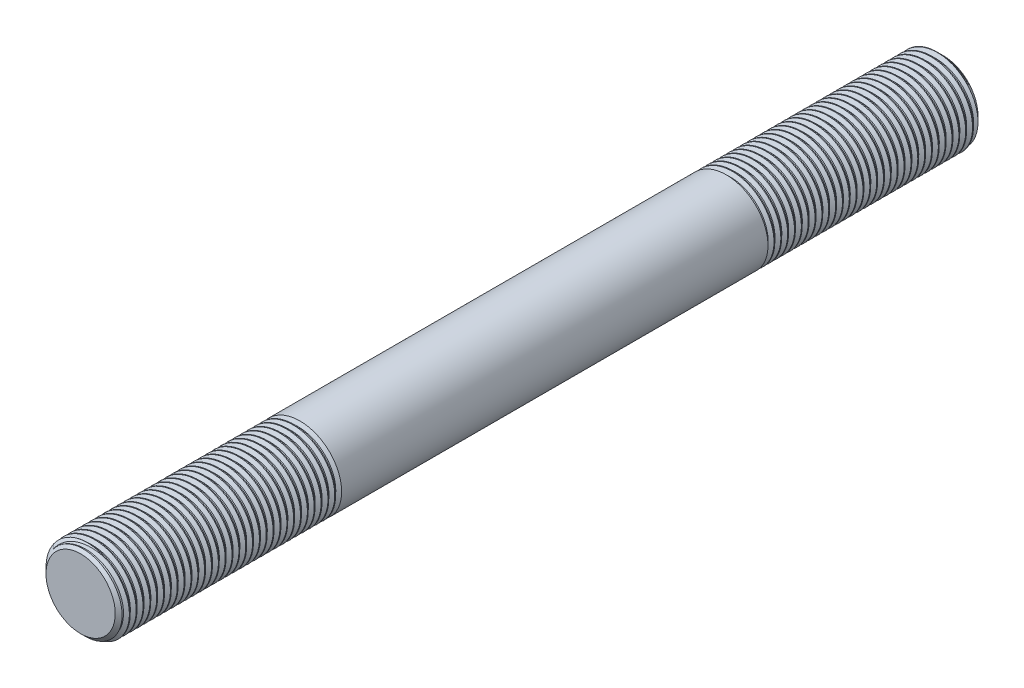
from build123d import *

# Parameters (mm, degrees)
SKETCH1_R           = 9.525
BOSS_EXTRUDE1_DEPTH = 100
CHAMFER1_SIZE       = 1.5
THREAD1_PITCH       = 1.5875
THREAD2_PITCH       = 1.5875


with BuildPart() as part:
    # Sketch1 → Boss-Extrude1 (new, symmetric)
    with BuildSketch(Plane.XY):
        Circle(SKETCH1_R)
    extrude(amount=BOSS_EXTRUDE1_DEPTH, both=True)

    # Chamfer1
    chamfer1_edges = [part.edges().sort_by_distance(p)[0] for p in [
        (-9.525, 0, -100),
        (-9.525, 0, 100),
    ]]
    chamfer(chamfer1_edges, length=CHAMFER1_SIZE)

    # Thread1: the profile of Thread Profile1 profile screwed along a right-hand helix of 32.755906 turns, 8 arcs to a turn; built about Z, then put on its axis
    thread1_z = Axis((0, 0, 0), (0, 0, 1))
    thread1_corners = [(9.5253, 0, -0.000173205), (9.5253, 0, 1.389235701), (8.665740423, 0, 0.892968748), (8.665740423, 0, 0.496093748)]
    with BuildLine(mode=Mode.PRIVATE) as thread1_profile:
        Line(thread1_corners[0], thread1_corners[1])
        Line(thread1_corners[1], thread1_corners[2])
        Line(thread1_corners[2], thread1_corners[3])
        Line(thread1_corners[3], thread1_corners[0])
    thread1_cap = Face(thread1_profile.wire())
    thread1_turn_angles = [0, 22.5, 45, 67.5, 90, 112.5, 135, 157.5, 180, 202.5, 225, 247.5, 270, 292.5, 315, 337.5, 360]
    thread1_turn_weights = [1, 0.9238795325112867, 1, 0.9238795325112867, 1, 0.9238795325112867, 1, 0.9238795325112867, 1, 0.9238795325112867, 1, 0.9238795325112867, 1, 0.9238795325112867, 1, 0.9238795325112867, 1]
    thread1_turn_rails = [Edge.make_bspline([Vector(p[0], p[1], 0).rotate(thread1_z, thread1_turn_angles[k]) / thread1_turn_weights[k] + Vector(0, 0, p[2] + THREAD1_PITCH * thread1_turn_angles[k] / 360) for k in range(17)], [0, 0, 0, 1, 1, 2, 2, 3, 3, 4, 4, 5, 5, 6, 6, 7, 7, 8, 8, 8], 2, thread1_turn_weights) for p in thread1_corners]
    thread1_turn_sides = [Face.make_surface_from_curves(thread1_turn_rails[p[0]], thread1_turn_rails[p[1]]) for p in [(0, 1), (1, 2), (2, 3), (3, 0)]]
    thread1_last_angles = [11520, 11542.5, 11565, 11587.5, 11610, 11632.5, 11655, 11677.5, 11700, 11722.5, 11745, 11767.5, 11790, 11791.062992126, 11792.125984252]
    thread1_last_weights = [1, 0.9238795325112867, 1, 0.9238795325112867, 1, 0.9238795325112867, 1, 0.9238795325112867, 1, 0.9238795325112867, 1, 0.9238795325112867, 1, 0.999827903365488, 1]
    thread1_last_rails = [Edge.make_bspline([Vector(p[0], p[1], 0).rotate(thread1_z, thread1_last_angles[k]) / thread1_last_weights[k] + Vector(0, 0, p[2] + THREAD1_PITCH * thread1_last_angles[k] / 360) for k in range(15)], [0, 0, 0, 1, 1, 2, 2, 3, 3, 4, 4, 5, 5, 6, 6, 7, 7, 7], 2, thread1_last_weights) for p in thread1_corners]
    thread1_last_sides = [Face.make_surface_from_curves(thread1_last_rails[p[0]], thread1_last_rails[p[1]]) for p in [(0, 1), (1, 2), (2, 3), (3, 0)]]
    thread1 = Plane(origin=(0, 0, 102), x_dir=(-1, 0, 0), z_dir=(0, 0, -1)) * Solid(Shell([*[p.moved(Location((0, 0, THREAD1_PITCH * i))) for i in range(32) for p in thread1_turn_sides], *thread1_last_sides, thread1_cap, thread1_cap.rotate(thread1_z, 11792.125984252).moved(Location((0, 0, THREAD1_PITCH * 11792.125984252 / 360)))]))
    add(thread1, mode=Mode.SUBTRACT)

    # Thread2: the profile of Thread Profile2 profile screwed along a right-hand helix of 32.755906 turns, 8 arcs to a turn; built about Z, then put on its axis
    thread2_z = Axis((0, 0, 0), (0, 0, 1))
    thread2_corners = [(9.5253, 0, -0.000173205), (9.5253, 0, 1.389235701), (8.665740423, 0, 0.892968748), (8.665740423, 0, 0.496093748)]
    with BuildLine(mode=Mode.PRIVATE) as thread2_profile:
        Line(thread2_corners[0], thread2_corners[1])
        Line(thread2_corners[1], thread2_corners[2])
        Line(thread2_corners[2], thread2_corners[3])
        Line(thread2_corners[3], thread2_corners[0])
    thread2_cap = Face(thread2_profile.wire())
    thread2_turn_angles = [0, 22.5, 45, 67.5, 90, 112.5, 135, 157.5, 180, 202.5, 225, 247.5, 270, 292.5, 315, 337.5, 360]
    thread2_turn_weights = [1, 0.9238795325112867, 1, 0.9238795325112867, 1, 0.9238795325112867, 1, 0.9238795325112867, 1, 0.9238795325112867, 1, 0.9238795325112867, 1, 0.9238795325112867, 1, 0.9238795325112867, 1]
    thread2_turn_rails = [Edge.make_bspline([Vector(p[0], p[1], 0).rotate(thread2_z, thread2_turn_angles[k]) / thread2_turn_weights[k] + Vector(0, 0, p[2] + THREAD2_PITCH * thread2_turn_angles[k] / 360) for k in range(17)], [0, 0, 0, 1, 1, 2, 2, 3, 3, 4, 4, 5, 5, 6, 6, 7, 7, 8, 8, 8], 2, thread2_turn_weights) for p in thread2_corners]
    thread2_turn_sides = [Face.make_surface_from_curves(thread2_turn_rails[p[0]], thread2_turn_rails[p[1]]) for p in [(0, 1), (1, 2), (2, 3), (3, 0)]]
    thread2_last_angles = [11520, 11542.5, 11565, 11587.5, 11610, 11632.5, 11655, 11677.5, 11700, 11722.5, 11745, 11767.5, 11790, 11791.062992126, 11792.125984252]
    thread2_last_weights = [1, 0.9238795325112867, 1, 0.9238795325112867, 1, 0.9238795325112867, 1, 0.9238795325112867, 1, 0.9238795325112867, 1, 0.9238795325112867, 1, 0.999827903365488, 1]
    thread2_last_rails = [Edge.make_bspline([Vector(p[0], p[1], 0).rotate(thread2_z, thread2_last_angles[k]) / thread2_last_weights[k] + Vector(0, 0, p[2] + THREAD2_PITCH * thread2_last_angles[k] / 360) for k in range(15)], [0, 0, 0, 1, 1, 2, 2, 3, 3, 4, 4, 5, 5, 6, 6, 7, 7, 7], 2, thread2_last_weights) for p in thread2_corners]
    thread2_last_sides = [Face.make_surface_from_curves(thread2_last_rails[p[0]], thread2_last_rails[p[1]]) for p in [(0, 1), (1, 2), (2, 3), (3, 0)]]
    thread2 = Plane(origin=(0, 0, -102), x_dir=(1, 0, 0), z_dir=(0, 0, 1)) * Solid(Shell([*[p.moved(Location((0, 0, THREAD2_PITCH * i))) for i in range(32) for p in thread2_turn_sides], *thread2_last_sides, thread2_cap, thread2_cap.rotate(thread2_z, 11792.125984252).moved(Location((0, 0, THREAD2_PITCH * 11792.125984252 / 360)))]))
    add(thread2, mode=Mode.SUBTRACT)


solid = part.part
